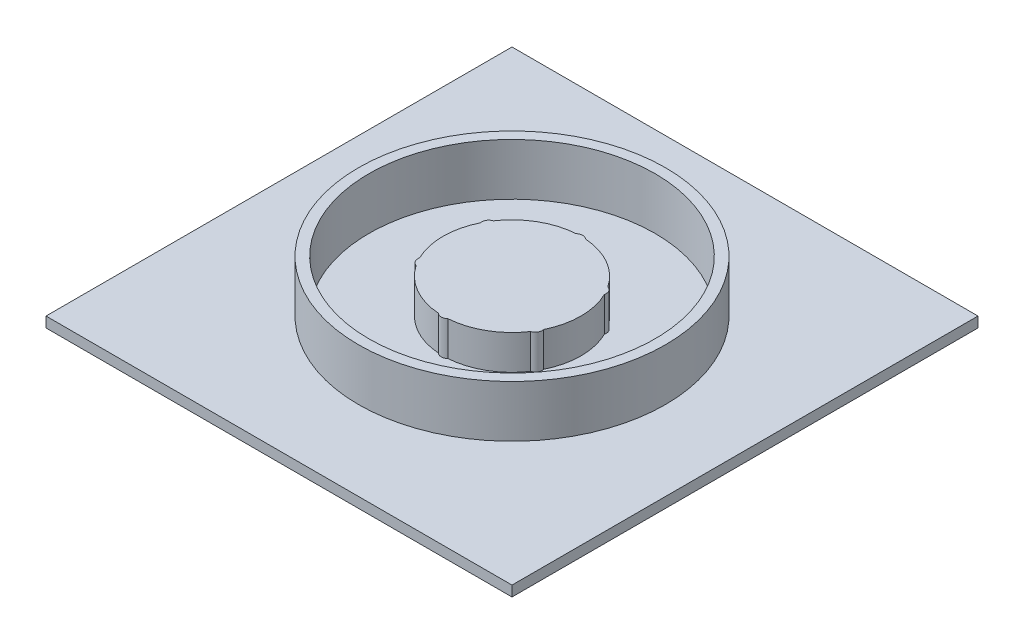
from build123d import *

# Parameters (mm, degrees)
SKETCH1_W           = 135
SKETCH1_H           = 135
BOSS_EXTRUDE1_DEPTH = 3
BOSS_EXTRUDE2_DEPTH = 10
SKETCH3_R           = 44.45
SKETCH3_R_2         = 41.45
BOSS_EXTRUDE3_DEPTH = 15


with BuildPart() as part:
    # Sketch1 → Boss-Extrude1 (new body)
    with BuildSketch(Plane(origin=(0, 0, 0), x_dir=(1, 0, 0), z_dir=(0, 1, 0))):
        with Locations((67.5, 67.5)):
            Rectangle(SKETCH1_W, SKETCH1_H)
    extrude(amount=BOSS_EXTRUDE1_DEPTH)

    # Sketch2 → Boss-Extrude2 (add)
    with BuildSketch(Plane(origin=(0, 3, 0), x_dir=(1, 0, 0), z_dir=(0, 1, 0))):
        with BuildLine():
            ThreePointArc((50.907776173, 56.333169273), (57.5, 50.179491924), (66.125352824, 47.547297297))
            ThreePointArc((66.125352824, 47.547297297), (67.5, 47), (68.874647176, 47.547297297))
            ThreePointArc((68.874647176, 47.547297297), (77.5, 50.179491924), (84.092223827, 56.333169273))
            ThreePointArc((84.092223827, 56.333169273), (85.253520778, 57.25), (85.466871003, 58.714128024))
            ThreePointArc((85.466871003, 58.714128024), (87.5, 67.5), (85.466871003, 76.285871976))
            ThreePointArc((85.466871003, 76.285871976), (85.253520778, 77.75), (84.092223827, 78.666830727))
            ThreePointArc((84.092223827, 78.666830727), (77.5, 84.820508076), (68.874647176, 87.452702703))
            ThreePointArc((68.874647176, 87.452702703), (67.5, 88), (66.125352824, 87.452702703))
            ThreePointArc((66.125352824, 87.452702703), (57.5, 84.820508076), (50.907776173, 78.666830727))
            ThreePointArc((50.907776173, 78.666830727), (49.746479222, 77.75), (49.533128997, 76.285871976))
            ThreePointArc((49.533128997, 76.285871976), (47.5, 67.5), (49.533128997, 58.714128024))
            ThreePointArc((49.533128997, 58.714128024), (49.746479222, 57.25), (50.907776173, 56.333169273))
        make_face()
    extrude(amount=BOSS_EXTRUDE2_DEPTH)

    # Sketch3 → Boss-Extrude3 (add)
    with BuildSketch(Plane(origin=(0, 3, 0), x_dir=(1, 0, 0), z_dir=(0, 1, 0))):
        with Locations((67.5, 67.5)):
            Circle(SKETCH3_R)
        with Locations((67.5, 67.5)):
            Circle(SKETCH3_R_2, mode=Mode.SUBTRACT)
    extrude(amount=BOSS_EXTRUDE3_DEPTH)


solid = part.part
